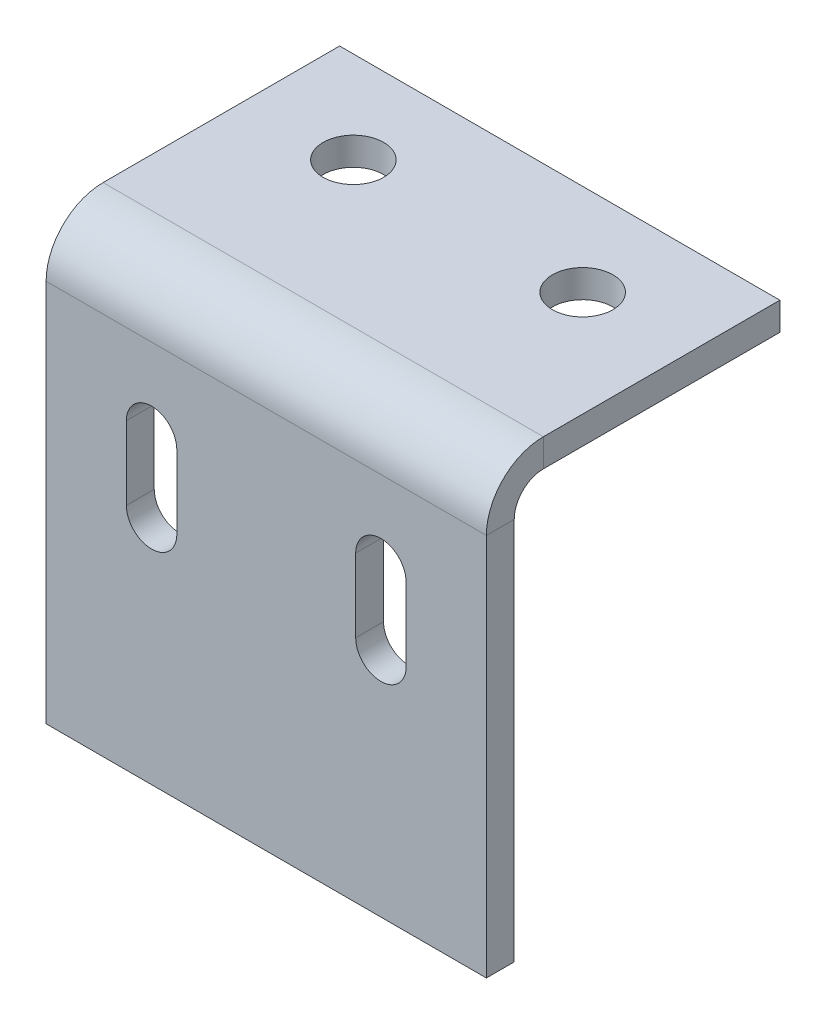
from build123d import *

# Parameters (mm, degrees)
SKETCH1_W                    = 48
SKETCH1_H                    = 32
BASE_FLANGE1_DEPTH           = 3.03784
EDGE_FLANGE1_STRIP_W         = 18.50136
EDGE_FLANGE1_STRIP_H         = 3.03784
EDGE_FLANGE1_STRIP_CUT_DEPTH = 48
EDGE_FLANGE1_DEPTH           = 48
M6_CLEARANCE_HOLE1_D         = 6.6
CUT_EXTRUDE1_DEPTH           = 63.481997407


# Sheet-metal steps are written as plain solids
with BuildPart() as part:
    # Sketch1 → Base-Flange1 (new body)
    with BuildSketch(Plane(origin=(0, 0, 0), x_dir=(1, 0, 0), z_dir=(0, 1, 0))):
        with Locations((0, 16)):
            Rectangle(SKETCH1_W, SKETCH1_H)
    extrude(amount=-BASE_FLANGE1_DEPTH)

    # Edge-Flange1 strip (across the edge) → Edge-Flange1 strip cut (cut)
    with BuildSketch(Plane(origin=(24, -3.03784, 0), x_dir=(0, 0, -1), z_dir=(-1, 0, 0))):
        with Locations((-3.03784, -1.51892)):
            Rectangle(EDGE_FLANGE1_STRIP_W, EDGE_FLANGE1_STRIP_H)
    extrude(amount=EDGE_FLANGE1_STRIP_CUT_DEPTH, mode=Mode.SUBTRACT)

    # Edge-Flange1 section (across the edge) → Edge-Flange1 (add)
    with BuildSketch(Plane(origin=(24, -3.03784, 0), x_dir=(0, 0, -1), z_dir=(-1, 0, 0))):
        with BuildLine():
            Line((0, 3.175), (0, 44.96216))
            Line((0, 44.96216), (3.03784, 44.96216))
            Line((3.03784, 44.96216), (3.03784, 3.175))
            ThreePointArc((3.03784, 3.175), (3.96777597, 0.92993597), (6.21284, 0))
            Line((6.21284, 0), (6.21284, -3.03784))
            ThreePointArc((6.21284, -3.03784), (1.819698706, -1.218141294), (0, 3.175))
        make_face()
    extrude(amount=EDGE_FLANGE1_DEPTH)

    # M6 Clearance Hole1 (through all)
    with Locations(Plane(origin=(0, -3.03784, 0), x_dir=(-1, 0, 0), z_dir=(0, -1, 0))):
        with Locations((12.5, 22), (-12.5, 22)):
            Hole(M6_CLEARANCE_HOLE1_D / 2)

    # Sketch13 → Cut-Extrude1 (cut, through all)
    with BuildSketch(Plane.XY):
        with BuildLine():
            Line((-9.75, -15), (-9.75, -23))
            ThreePointArc((-9.75, -23), (-12.5, -25.75), (-15.25, -23))
            Line((-15.25, -23), (-15.25, -15))
            ThreePointArc((-15.25, -15), (-12.5, -12.25), (-9.75, -15))
        make_face()
        with BuildLine():
            Line((15.25, -15), (15.25, -23))
            ThreePointArc((15.25, -23), (12.5, -25.75), (9.75, -23))
            Line((9.75, -23), (9.75, -15))
            ThreePointArc((9.75, -15), (12.5, -12.25), (15.25, -15))
        make_face()
    extrude(amount=-CUT_EXTRUDE1_DEPTH, mode=Mode.SUBTRACT)


solid = part.part
